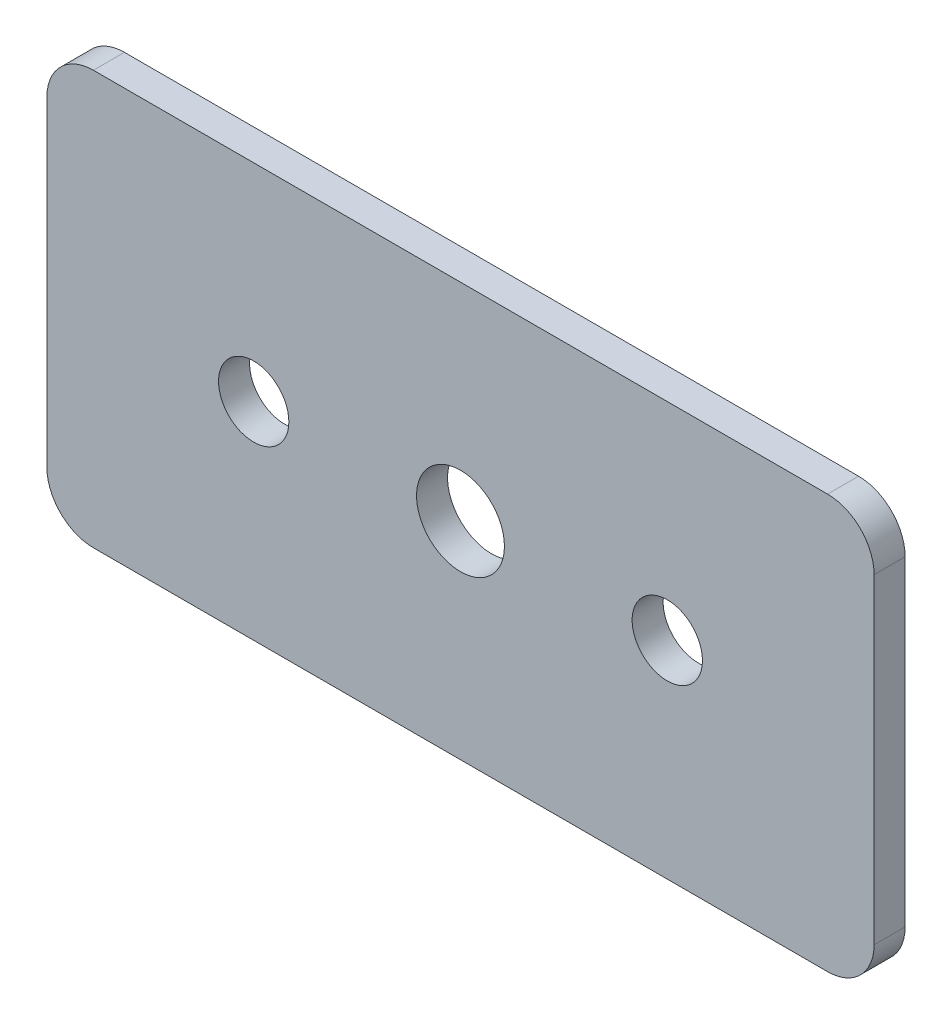
from build123d import *

# Parameters (mm, degrees)
SKETCH_1_W             = 80
SKETCH_1_H             = 40
SM_BASE_FLANGE_1_DEPTH = 3
OTHER_START            = -3
OTHER_1_DEPTH          = 3
HOLE_WIZARD_M8_1_D     = 6.8
HOLE_WIZARD_M10_1_D    = 8.5


# Read off the part's stored shape, not the designer's step: 断开-边角1
# Sheet-metal steps are written as plain solids
with BuildPart() as part:
    # Sketch 1 → 基体-法兰1 (new body)
    with BuildSketch(Plane.XY):
        Rectangle(SKETCH_1_W, SKETCH_1_H)
    extrude(amount=-SM_BASE_FLANGE_1_DEPTH)

    # Other 1 outline → Other 1 (cut)
    with BuildSketch(Plane.XY.offset(OTHER_START)):
        with BuildLine():
            ThreePointArc((40, -15.5), (38.681980515, -18.681980515), (35.5, -20))
            Line((35.5, -20), (40, -20))
            Line((40, -20), (40, -15.5))
        make_face()
        with BuildLine():
            Line((-40, -20), (-35.5, -20))
            ThreePointArc((-35.5, -20), (-38.681980515, -18.681980515), (-40, -15.5))
            Line((-40, -15.5), (-40, -20))
        make_face()
        with BuildLine():
            ThreePointArc((35.5, 20), (38.681980515, 18.681980515), (40, 15.5))
            Line((40, 15.5), (40, 20))
            Line((40, 20), (35.5, 20))
        make_face()
        with BuildLine():
            Line((-40, 20), (-40, 15.5))
            ThreePointArc((-40, 15.5), (-38.681980515, 18.681980515), (-35.5, 20))
            Line((-35.5, 20), (-40, 20))
        make_face()
    extrude(amount=OTHER_1_DEPTH, mode=Mode.SUBTRACT)

    # M8 螺纹孔1 (through all)
    with Locations(Plane.XY):
        with Locations((-20, 0), (20, 0)):
            Hole(HOLE_WIZARD_M8_1_D / 2)

    # M10 螺纹孔1 (through all)
    with Locations(Plane.XY):
        with Locations((0, 0)):
            Hole(HOLE_WIZARD_M10_1_D / 2)


solid = part.part
